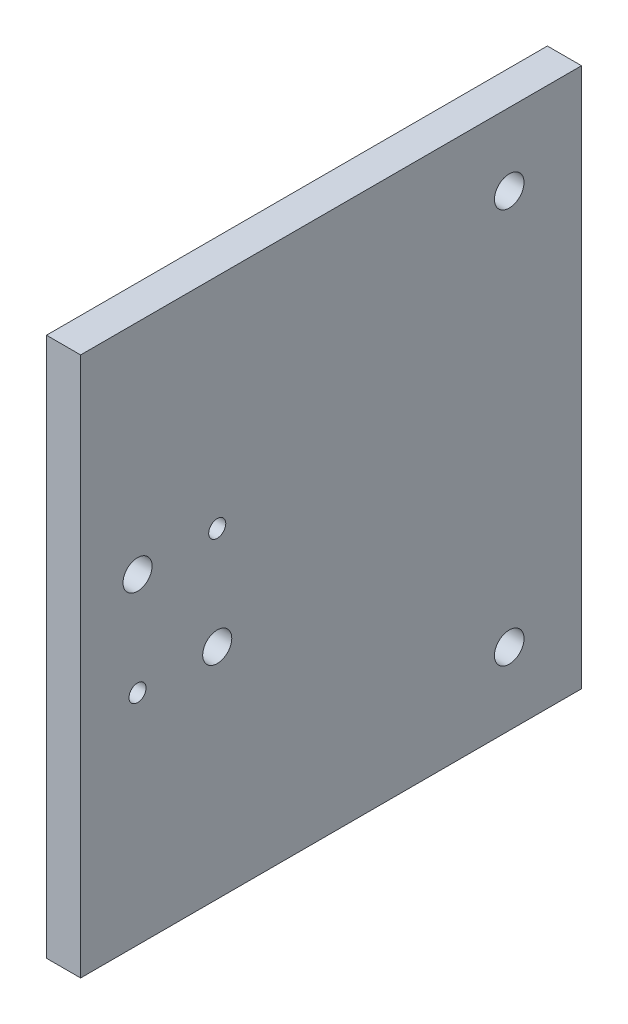
from build123d import *

# Parameters (mm, degrees)
SKETCH1_R           = 1.5
SKETCH1_R_2         = 2.555
SKETCH1_R_3         = 2.6
BOSS_EXTRUDE1_DEPTH = 6


with BuildPart() as part:
    # Sketch1 → Boss-Extrude1 (new body)
    with BuildSketch(Plane.YZ):
        Polygon((-47.4, -25), (-47.4, -71), (47.4, -71), (47.4, 17), (-47.4, 17), (-47.4, 16), align=None)
        with Locations((-9, 7)):
            Circle(SKETCH1_R, mode=Mode.SUBTRACT)
        with Locations((-9, -7)):
            Circle(SKETCH1_R_2, mode=Mode.SUBTRACT)
        with Locations((9, -7)):
            Circle(SKETCH1_R, mode=Mode.SUBTRACT)
        with Locations((9, 7)):
            Circle(SKETCH1_R_2, mode=Mode.SUBTRACT)
        with Locations((-34.7, -58.3)):
            Circle(SKETCH1_R_3, mode=Mode.SUBTRACT)
        with Locations((34.7, -58.3)):
            Circle(SKETCH1_R_3, mode=Mode.SUBTRACT)
    extrude(amount=BOSS_EXTRUDE1_DEPTH)


solid = part.part
